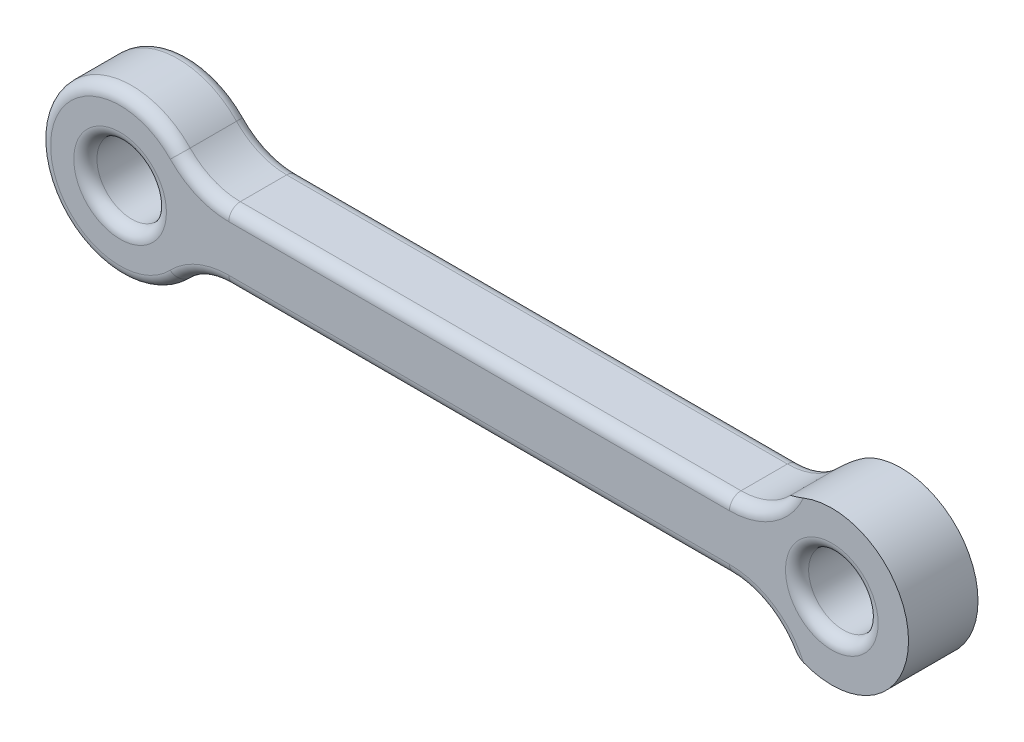
from build123d import *

# Parameters (mm, degrees)
SKETCH1_R           = 1.5
SKETCH1_R_2         = 1.500000000000004
BOSS_EXTRUDE1_DEPTH = 3
FILLET1_R           = 0.5
SCALE1_SCALE        = 1.9


with BuildPart() as part:
    # Sketch1 → Boss-Extrude1 (new body)
    with BuildSketch(Plane.XY):
        with BuildLine():
            Line((4.690415759823431, 1.5), (26.30958424017657, 1.5))
            ThreePointArc((26.30958424017657, 1.5), (27.486281051005673, 1.7404013669766005), (28.474391513941228, 2.4230769230769225))
            ThreePointArc((28.474391513941228, 2.4230769230769225), (34.04044882418204, 0), (28.474391513941228, -2.4230769230769225))
            ThreePointArc((28.474391513941228, -2.4230769230769225), (27.486281051005673, -1.7404013669766005), (26.30958424017657, -1.5))
            Line((26.30958424017657, -1.5), (4.690415759823431, -1.5))
            ThreePointArc((4.690415759823431, -1.5), (3.5137189489943266, -1.7404013669766005), (2.5256084860587706, -2.4230769230769234))
            ThreePointArc((2.5256084860587706, -2.4230769230769234), (-3.500000000000001, 4.3e-16), (2.5256084860587706, 2.4230769230769234))
            ThreePointArc((2.5256084860587706, 2.4230769230769234), (3.5137189489943266, 1.7404013669766005), (4.690415759823431, 1.5))
        make_face()
        Circle(SKETCH1_R, mode=Mode.SUBTRACT)
        with Locations((30.73, 0)):
            Circle(SKETCH1_R_2, mode=Mode.SUBTRACT)
    extrude(amount=-BOSS_EXTRUDE1_DEPTH)

    # Fillet1
    # the kernel refuses this fillet: 0.5 mm, written as the material it takes off along each edge
    with BuildSketch(Plane(origin=(-6e-17, 2.2e-16, 0), x_dir=(0.7216024245882201, -0.6923076923076922, 0), z_dir=(0.6923076923076922, 0.7216024245882201, 0))) as fillet1_piece_1:
        with BuildLine():
            CenterArc((3.5000000000000013 - FILLET1_R, FILLET1_R), FILLET1_R, 269.99999999999994, 90.00000000000006)
            Line((3.5000000000000013 - FILLET1_R, -6e-17), (3.5000000000000013, 0))
            Line((3.5000000000000013, 0), (3.5000000000000013, FILLET1_R))
        make_face()
    revolve(axis=Axis((-6e-17, 2.2e-16, 0), (0, 0, -1)), revolution_arc=272.37387707919373, mode=Mode.SUBTRACT)
    with BuildSketch(Plane(origin=(4.6904157598234315, 4.5, 0), x_dir=(-0.7216024245882201, -0.6923076923076921, 0), z_dir=(-0.6923076923076921, 0.7216024245882201, 0))) as fillet1_piece_2:
        with BuildLine():
            CenterArc((3 + FILLET1_R, -FILLET1_R), FILLET1_R, 89.99999999999994, 90.00000000000006)
            Line((3 + FILLET1_R, 6e-17), (3, 0))
            Line((3, 0), (2.9999999999999996, -FILLET1_R))
        make_face()
    revolve(axis=Axis((4.6904157598234315, 4.5, 0), (0, 0, 1)), revolution_arc=46.18693853959685, mode=Mode.SUBTRACT)
    with BuildSketch(Plane(origin=(4.690415759823431, 1.5, 0), x_dir=(0, 0, -1), z_dir=(1, 0, 0)), Plane(origin=(26.30958424017657, -1.5, 0), x_dir=(0, 0, -1), z_dir=(-1, 0, 0))) as fillet1_piece_3:
        with BuildLine():
            CenterArc((FILLET1_R, -FILLET1_R), FILLET1_R, 90, 90)
            Line((-6e-17, -FILLET1_R), (0, 0))
            Line((0, 0), (FILLET1_R, 0))
        make_face()
    extrude(amount=21.61916848035314, mode=Mode.SUBTRACT)
    with BuildSketch(Plane(origin=(26.309584240176566, 4.500000000000009, 0), x_dir=(1.18e-15, -1, 0), z_dir=(-1, -1.18e-15, 0))) as fillet1_piece_4:
        with BuildLine():
            CenterArc((3.000000000000009 + FILLET1_R, -FILLET1_R), FILLET1_R, 90, 90)
            Line((3.000000000000009 + FILLET1_R, 6e-17), (3.000000000000009, 0))
            Line((3.000000000000009, 0), (3.000000000000009, -FILLET1_R))
        make_face()
    revolve(axis=Axis((26.309584240176566, 4.500000000000009, 0), (0, 0, 1)), revolution_arc=70.06270514317328, mode=Mode.SUBTRACT)
    with BuildSketch(Plane(origin=(4.6904157598234315, 4.5, -3), x_dir=(-0.7216024245882201, -0.6923076923076921, 0), z_dir=(-0.6923076923076921, 0.7216024245882201, 0))) as fillet1_piece_5:
        with BuildLine():
            CenterArc((3 + FILLET1_R, FILLET1_R), FILLET1_R, 180, 90.00000000000006)
            Line((3 + FILLET1_R, 0), (3, 0))
            Line((3, 0), (2.9999999999999996, FILLET1_R))
        make_face()
    revolve(axis=Axis((4.6904157598234315, 4.5, -3), (0, 0, 1)), revolution_arc=46.18693853959685, mode=Mode.SUBTRACT)
    with BuildSketch(Plane(origin=(-6e-17, 2.2e-16, -3), x_dir=(0.7216024245882201, -0.6923076923076922, 0), z_dir=(0.6923076923076922, 0.7216024245882201, 0))) as fillet1_piece_6:
        with BuildLine():
            CenterArc((3.5000000000000013 - FILLET1_R, -FILLET1_R), FILLET1_R, 0, 90.00000000000006)
            Line((3.5000000000000013 - FILLET1_R, 0), (3.5000000000000013, 0))
            Line((3.5000000000000013, 0), (3.5000000000000013, -FILLET1_R))
        make_face()
    revolve(axis=Axis((-6e-17, 2.2e-16, -3), (0, 0, -1)), revolution_arc=272.37387707919373, mode=Mode.SUBTRACT)
    with BuildSketch(Plane(origin=(4.6904157598234315, -4.500000000000001, -3), x_dir=(-3e-16, 1, 0), z_dir=(1, 3e-16, 0))) as fillet1_piece_7:
        with BuildLine():
            CenterArc((3.0000000000000013 + FILLET1_R, FILLET1_R), FILLET1_R, 180, 90)
            Line((3.0000000000000013 + FILLET1_R, 0), (3.0000000000000013, 0))
            Line((3.0000000000000013, 0), (3.0000000000000013, FILLET1_R))
        make_face()
    revolve(axis=Axis((4.6904157598234315, -4.500000000000001, -3), (0, 0, 1)), revolution_arc=46.186938539596845, mode=Mode.SUBTRACT)
    with BuildSketch(Plane(origin=(0, 0, 0), x_dir=(1, 0, 0), z_dir=(0, -1, 0))) as fillet1_piece_8:
        with BuildLine():
            CenterArc((1.5 + FILLET1_R, -FILLET1_R), FILLET1_R, 90, 90)
            Line((1.5 + FILLET1_R, 6e-17), (1.5, 0))
            Line((1.5, 0), (1.5, -FILLET1_R))
        make_face()
    revolve(axis=Axis((0, 0, 0), (0, 0, 1)), mode=Mode.SUBTRACT)
    with BuildSketch(Plane(origin=(26.30958424017657, -1.5, -3), x_dir=(0, 0, 1), z_dir=(-1, 0, 0)), Plane(origin=(4.690415759823431, 1.5, -3), x_dir=(0, 0, 1), z_dir=(1, 0, 0))) as fillet1_piece_9:
        with BuildLine():
            CenterArc((FILLET1_R, FILLET1_R), FILLET1_R, 180, 90)
            Line((0, FILLET1_R), (0, 0))
            Line((0, 0), (FILLET1_R, 0))
        make_face()
    extrude(amount=21.61916848035314, mode=Mode.SUBTRACT)
    with BuildSketch(Plane(origin=(30.73, 0, -3), x_dir=(1, 0, 0), z_dir=(0, -1, 0))) as fillet1_piece_10:
        with BuildLine():
            CenterArc((1.5000000000000036 + FILLET1_R, FILLET1_R), FILLET1_R, 180, 90)
            Line((1.5000000000000036 + FILLET1_R, 0), (1.5000000000000036, 0))
            Line((1.5000000000000036, 0), (1.5000000000000036, FILLET1_R))
        make_face()
    revolve(axis=Axis((30.73, 0, -3), (0, 0, 1)), mode=Mode.SUBTRACT)
    with BuildSketch(Plane(origin=(30.73, 0, 0), x_dir=(1, 0, 0), z_dir=(0, -1, 0))) as fillet1_piece_11:
        with BuildLine():
            CenterArc((1.5000000000000036 + FILLET1_R, -FILLET1_R), FILLET1_R, 90, 90)
            Line((1.5000000000000036 + FILLET1_R, 6e-17), (1.5000000000000036, 0))
            Line((1.5000000000000036, 0), (1.5000000000000036, -FILLET1_R))
        make_face()
    revolve(axis=Axis((30.73, 0, 0), (0, 0, 1)), mode=Mode.SUBTRACT)
    with BuildSketch(Plane(origin=(26.309584240176562, -4.500000000000011, -3), x_dir=(0.9400663686370947, 0.3409915285714087, 0), z_dir=(0.3409915285714087, -0.9400663686370947, 0))) as fillet1_piece_12:
        with BuildLine():
            CenterArc((3.0000000000000124 + FILLET1_R, FILLET1_R), FILLET1_R, 180, 90.00000000000023)
            Line((3.0000000000000124 + FILLET1_R, 0), (3.0000000000000124, 0))
            Line((3.0000000000000124, 0), (3.00000000000001, FILLET1_R))
        make_face()
    revolve(axis=Axis((26.309584240176562, -4.500000000000011, -3), (0, 0, 1)), revolution_arc=70.0627051431732, mode=Mode.SUBTRACT)
    with BuildSketch(Plane(origin=(26.309584240176566, 4.500000000000009, -3), x_dir=(1.18e-15, -1, 0), z_dir=(-1, -1.18e-15, 0))) as fillet1_piece_13:
        with BuildLine():
            CenterArc((3.000000000000009 + FILLET1_R, FILLET1_R), FILLET1_R, 180, 90)
            Line((3.000000000000009 + FILLET1_R, 0), (3.000000000000009, 0))
            Line((3.000000000000009, 0), (3.000000000000009, FILLET1_R))
        make_face()
    revolve(axis=Axis((26.309584240176566, 4.500000000000009, -3), (0, 0, 1)), revolution_arc=70.06270514317328, mode=Mode.SUBTRACT)
    with BuildSketch(Plane(origin=(26.309584240176562, -4.500000000000011, 0), x_dir=(0.9400663686370947, 0.34099152857140885, 0), z_dir=(0.34099152857140885, -0.9400663686370947, 0))) as fillet1_piece_14:
        with BuildLine():
            CenterArc((3.000000000000013 + FILLET1_R, -FILLET1_R), FILLET1_R, 89.99999999999969, 90.00000000000034)
            Line((3.000000000000013 + FILLET1_R, 6e-17), (3.000000000000013, 0))
            Line((3.000000000000013, 0), (3.00000000000001, -FILLET1_R))
        make_face()
    revolve(axis=Axis((26.309584240176562, -4.500000000000011, 0), (0, 0, 1)), revolution_arc=70.0627051431732, mode=Mode.SUBTRACT)
    with BuildSketch(Plane(origin=(4.6904157598234315, -4.500000000000001, 0), x_dir=(-3e-16, 1, 0), z_dir=(1, 3e-16, 0))) as fillet1_piece_15:
        with BuildLine():
            CenterArc((3.0000000000000013 + FILLET1_R, -FILLET1_R), FILLET1_R, 90, 90)
            Line((3.0000000000000013 + FILLET1_R, 6e-17), (3.0000000000000013, 0))
            Line((3.0000000000000013, 0), (3.0000000000000013, -FILLET1_R))
        make_face()
    revolve(axis=Axis((4.6904157598234315, -4.500000000000001, 0), (0, 0, 1)), revolution_arc=46.186938539596845, mode=Mode.SUBTRACT)


with BuildPart() as part_1:
    # Scale1: scaled about (14.97872549, -2.3e-08, -1.501949576)
    add(part.part.scale(SCALE1_SCALE).moved(Location((-13.480852940999998, 2.07e-08, 1.3517546183999998))))


solid = part_1.part
